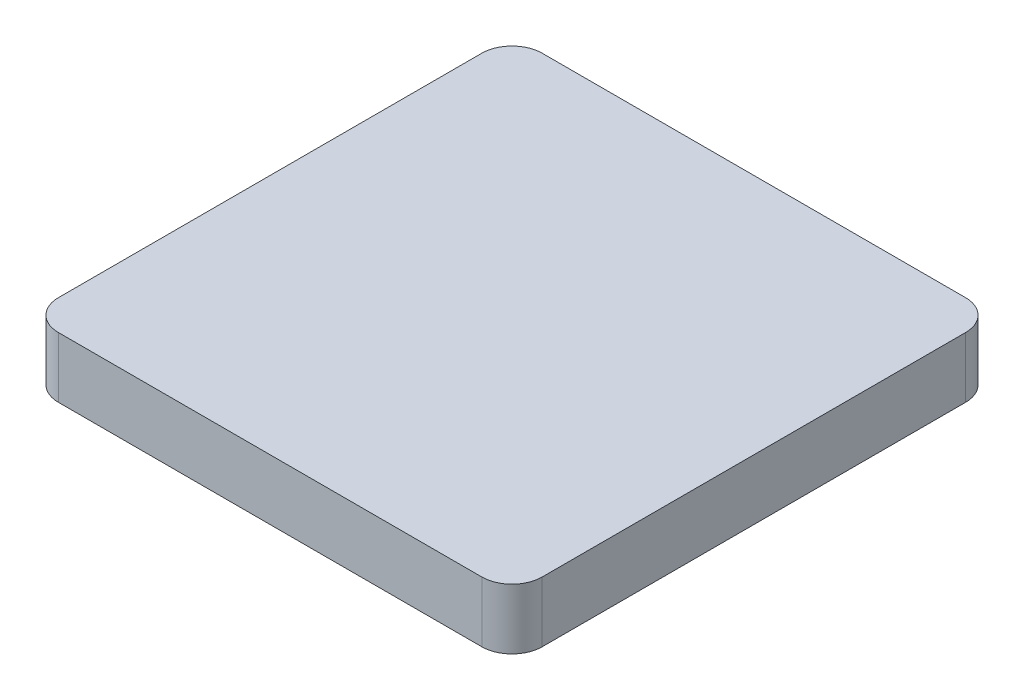
from build123d import *

# Parameters (mm, degrees)
ESQUISSE1_W             = 80
ESQUISSE1_H             = 80
EXTRUSION1_DEPTH        = 10
ESQUISSE2_W             = 24.5
ESQUISSE2_H             = 11
ENL_V_MAT_EXTRU_1_DEPTH = 8
CHANFREIN1_SIZE         = 8
CHANFREIN2_SIZE         = 8
CONG_1_R                = 5
ESQUISSE3_W             = 5
ESQUISSE3_H             = 5
ENL_V_MAT_EXTRU_2_DEPTH = 5


with BuildPart() as part:
    # Esquisse1 → Extrusion1 (new body)
    with BuildSketch(Plane(origin=(0, 0, 0), x_dir=(1, 0, 0), z_dir=(0, 1, 0))):
        with Locations((40, 40)):
            Rectangle(ESQUISSE1_W, ESQUISSE1_H)
    extrude(amount=EXTRUSION1_DEPTH)

    # Esquisse2 → Enlèv. mat.-Extru.1 (cut)
    with BuildSketch(Plane.XZ):
        with Locations((23.75, -40)):
            Rectangle(ESQUISSE2_W, ESQUISSE2_H)
    extrude(amount=-ENL_V_MAT_EXTRU_1_DEPTH, mode=Mode.SUBTRACT)

    # Chanfrein1
    chanfrein1_edges = [part.edges().sort_by_distance(p)[0] for p in [
        (11.5, 0, -40),
    ]]
    chamfer(chanfrein1_edges, length=CHANFREIN1_SIZE - 0.0001)  # a hair under: the kernel refuses the full size

    # Chanfrein2
    chanfrein2_edges = [part.edges().sort_by_distance(p)[0] for p in [
        (36, 0, -40),
    ]]
    chamfer(chanfrein2_edges, length=CHANFREIN2_SIZE - 0.0001)  # a hair under: the kernel refuses the full size

    # Congé1
    cong_1_edges = [part.edges().sort_by_distance(p)[0] for p in [
        (0, 5, -80),
        (80, 5, -80),
        (80, 5, 0),
        (0, 5, 0),
    ]]
    fillet(cong_1_edges, radius=CONG_1_R)

    # Esquisse3 → Enlèv. mat.-Extru.2 (cut)
    with BuildSketch(Plane.XZ):
        with Locations((46.5, -40)):
            Rectangle(ESQUISSE3_W, ESQUISSE3_H)
    extrude(amount=-ENL_V_MAT_EXTRU_2_DEPTH, mode=Mode.SUBTRACT)


solid = part.part
